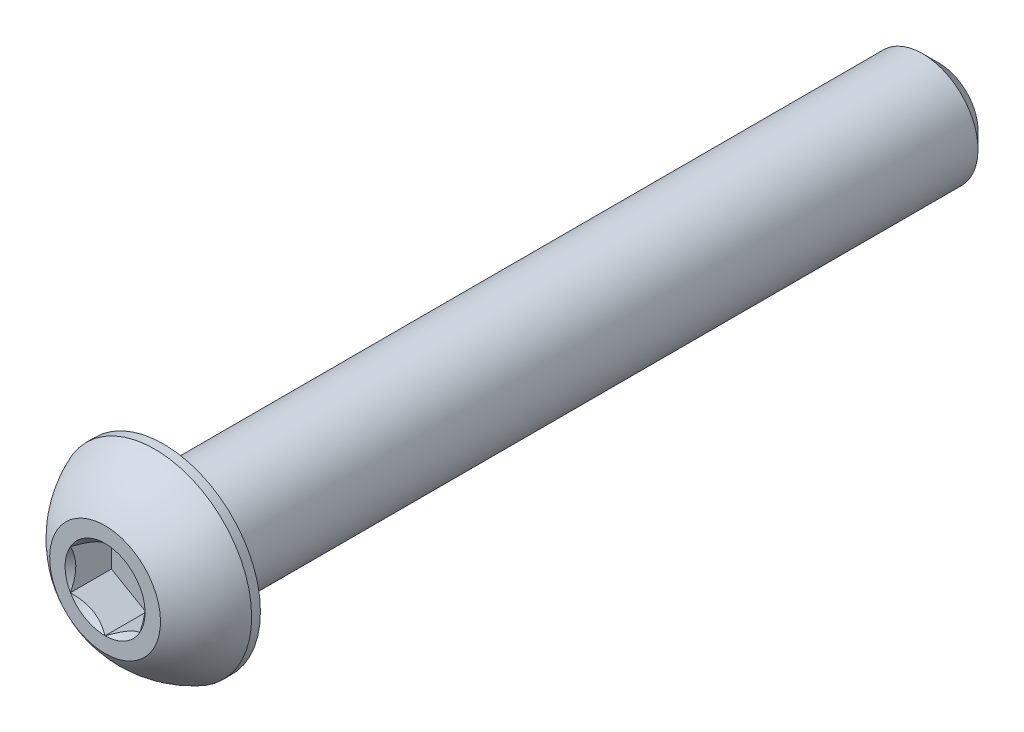
from build123d import *

# Parameters (mm, degrees)
SKETCH1_W          = 44.45
SKETCH1_H          = 3.175
CHAMFER1_SIZE      = 0.9525
CUT_EXTRUDE2_DEPTH = 2.34696


with BuildPart() as part:
    # Sketch1 → Revolve1 (revolve)
    with BuildSketch(Plane(origin=(0, 0, 0), x_dir=(0, 0, -1), z_dir=(1, 0, 0))):
        with Locations((25.5778, 1.5875)):
            Rectangle(SKETCH1_W, SKETCH1_H)
    revolve(axis=Axis((0, 0, -47.8028), (0, 0, 1)))

    # Chamfer1
    chamfer1_edges = [part.edges().sort_by_distance(p)[0] for p in [
        (0, -3.175, -47.8028),
    ]]
    chamfer(chamfer1_edges, length=CHAMFER1_SIZE)

    # Sketch7 → Revolve2 (revolve)
    with BuildSketch(Plane(origin=(0, 0, 0), x_dir=(0, 0, -1), z_dir=(1, 0, 0))):
        with BuildLine():
            Line((2.84988, 5.5499), (3.3528, 5.5499))
            Line((3.3528, 5.5499), (3.3528, 0))
            Line((3.3528, 0), (0, 0))
            Line((0, 0), (0, 3.175))
            ThreePointArc((0, 3.175), (1.235921075, 4.58927271), (2.84988, 5.5499))
        make_face()
    revolve(axis=Axis((0, 0, 0), (0, 0, -1)))

    # Sketch5 → Cut-Extrude2 (cut)
    with BuildSketch(Plane.XY):
        Polygon((1.984375, -1.14567944), (1.984375, 1.14567944), (0, 2.291358881), (-1.984375, 1.14567944), (-1.984375, -1.14567944), (0, -2.291358881), align=None)
    extrude(amount=-CUT_EXTRUDE2_DEPTH, mode=Mode.SUBTRACT)

    # Cut-Extrude3 cone 1 section (through the dimple's axis) → Cut-Extrude3 (revolve, cut)
    with BuildSketch(Plane(origin=(0, 0, 0), x_dir=(0, -1, 0), z_dir=(1, 0, 0))):
        Polygon((0, 0), (2.291358881, 0), (0, 2.291358881), align=None)
    revolve(axis=Axis((0, 0, 0), (0, 0, -1)), mode=Mode.SUBTRACT)


solid = part.part
